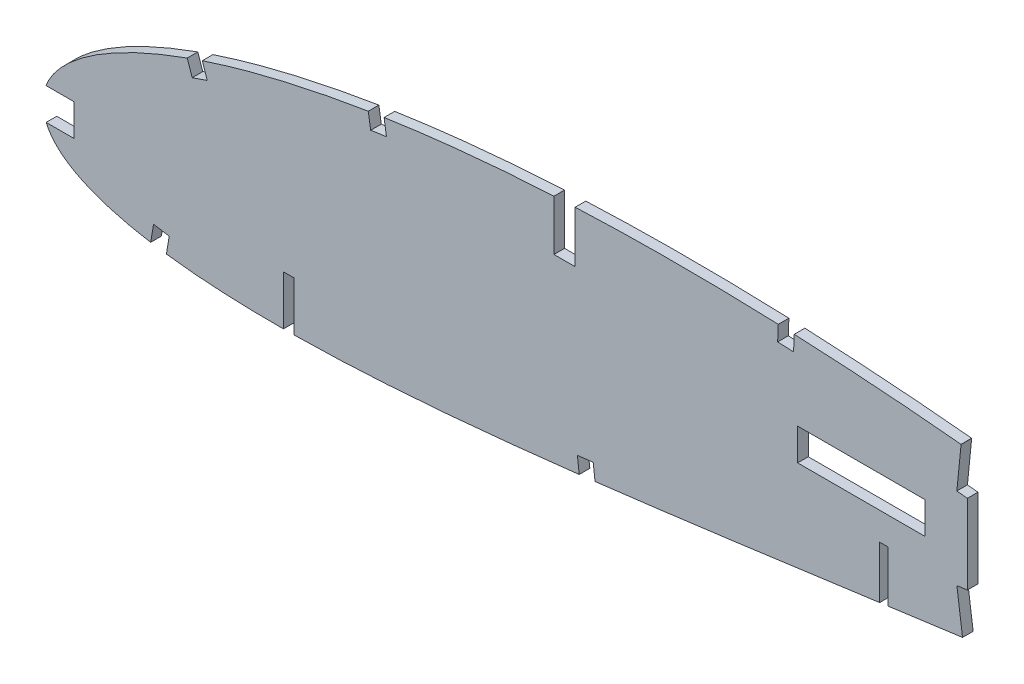
from build123d import *

# Parameters (mm, degrees)
BOSS_EXTRUDE1_DEPTH = 3.175
CUT_EXTRUDE1_DEPTH  = 7.62
SKETCH3_R           = 6.35
CUT_EXTRUDE2_DEPTH  = 7.62
SKETCH4_R           = 6.35
SKETCH4_W           = 9.525
SKETCH4_H           = 9.525
SKETCH4_W_2         = 38.1
CUT_EXTRUDE3_DEPTH  = 443.627115857


with BuildPart() as part:
    # Sketch1 → Boss-Extrude1 (new body)
    with BuildSketch(Plane.XY):
        with BuildLine():
            Line((435.33010469, 0.678691456), (439.172882547, -1.614212492))
            Line((439.172882547, -1.614212492), (434.787151486, -0.678691456))
            add(Edge.make_bspline(
                [(0, 0), (0.11179123, -0.527729161), (0.335887463, -1.58561283), (0.94472768, -3.108527015), (1.749889805, -4.572488672), (2.768272335, -5.973609192), (3.993104005, -7.311505618), (5.421679636, -8.587569541), (7.052598221, -9.801114861), (8.883725224, -10.951589231), (10.912400596, -12.040213999), (13.136344152, -13.066312264), (15.553528081, -14.029563428), (18.161318821, -14.928679795), (20.956528242, -15.765030781), (23.936498821, -16.536578215), (27.097842034, -17.244400464), (30.437517266, -17.886690773), (33.951885298, -18.464101669), (37.637295209, -18.976309975), (41.489964184, -19.423636044), (45.506112459, -19.80514129), (49.681767661, -20.121646285), (54.012767863, -20.373360955), (58.494909036, -20.561083494), (63.123897762, -20.684100336), (67.895200479, -20.744329207), (72.804505265, -20.742674403), (77.847009648, -20.678693244), (83.018406129, -20.555920262), (88.313732191, -20.373577887), (93.728207214, -20.133872554), (99.256947275, -19.839216685), (104.89499369, -19.49060908), (110.637384794, -19.089594814), (116.479134607, -18.639389777), (122.414936441, -18.141116951), (128.439613477, -17.597680601), (134.547832047, -17.011801372), (140.734314746, -16.385333349), (146.993600903, -15.721223571), (153.320115485, -15.021624036), (159.708476563, -14.290267097), (166.152848405, -13.528475979), (172.647781594, -12.740600204), (179.187166024, -11.928145018), (185.765533466, -11.094239816), (192.376967293, -10.242811017), (199.015278084, -9.37376151), (205.674882543, -8.493282903), (212.349358377, -7.600650086), (219.032895906, -6.7004538), (225.719308248, -5.795492203), (232.402082768, -4.886043807), (239.075345122, -3.975877517), (245.732904616, -3.06749205), (252.368240069, -2.160970285), (258.975348295, -1.26081803), (265.547576185, -0.366925322), (272.078863439, 0.518895586), (278.562951189, 1.394000598), (284.993721977, 2.257285217), (291.364542133, 3.108203268), (297.66900214, 3.947074317), (303.806375969, 4.748436439), (309.760626579, 5.554962658), (315.551818652, 6.216135275), (321.27090305, 6.780469964), (326.923820465, 7.243146515), (332.503782957, 7.610821489), (338.004397185, 7.886122043), (343.419107553, 8.072891719), (348.74107448, 8.176671364), (353.963650696, 8.200094537), (359.079707468, 8.150631139), (364.082590991, 8.032268225), (368.965318868, 7.850318702), (373.721079318, 7.610921079), (378.343117125, 7.320601554), (382.824493294, 6.983642622), (387.158963185, 6.607910686), (391.339839301, 6.198906082), (395.360701925, 5.761301701), (399.215684034, 5.304267166), (402.898615263, 4.830811549), (406.403955911, 4.348715399), (409.726063296, 3.862864382), (412.859676284, 3.379461168), (415.799871302, 2.903117573), (418.541899149, 2.440155772), (421.081464376, 1.994901374), (423.414160264, 1.571702591), (425.536750687, 1.175899009), (427.445043551, 0.809456817), (429.136486586, 0.478415007), (430.607934716, 0.184234372), (431.857230885, -0.068940506), (432.88219343, -0.280110359), (433.681265576, -0.445808771), (434.252869013, -0.566300363), (434.596385478, -0.637999126), (434.749014267, -0.670556399), (434.787151486, -0.678691456)],
                knots=[0, 0, 0, 0, 0.003638255, 0.007293231, 0.011028136, 0.014901081, 0.018963272, 0.023258475, 0.027820626, 0.032679082, 0.03785316, 0.043361875, 0.049214679, 0.055422346, 0.061988786, 0.068918036, 0.076211157, 0.083868392, 0.091887411, 0.100265912, 0.108999867, 0.118084529, 0.127514843, 0.13728527, 0.147387917, 0.157816481, 0.168563473, 0.179619128, 0.190977373, 0.202626974, 0.214560478, 0.226767249, 0.239236417, 0.251959004, 0.264923894, 0.278119703, 0.291536035, 0.30516028, 0.318980685, 0.332985499, 0.34716279, 0.361498603, 0.375980747, 0.390597192, 0.405332593, 0.420174823, 0.435109533, 0.450124276, 0.465203068, 0.480333154, 0.495500583, 0.510689775, 0.525887334, 0.541078314, 0.556247233, 0.571381785, 0.58646604, 0.601484515, 0.616424329, 0.631269423, 0.646006524, 0.660620684, 0.675098187, 0.689422858, 0.703581825, 0.716907563, 0.730009274, 0.742952128, 0.755725557, 0.768319951, 0.780724337, 0.792926528, 0.804916041, 0.816679084, 0.828203525, 0.8394749, 0.850481359, 0.861207697, 0.871639326, 0.881763414, 0.891563605, 0.901027365, 0.910138977, 0.918883977, 0.927249278, 0.935221104, 0.942784739, 0.949928188, 0.956638465, 0.962904203, 0.968712288, 0.974054485, 0.978918432, 0.983297219, 0.987180246, 0.990560674, 0.993433357, 0.995790626, 0.997629588, 0.998945816, 0.999736592, 1, 1, 1, 1], degree=3))
            add(Edge.make_bspline(
                [(435.33010469, 0.678691456), (435.296755582, 0.699293055), (435.163488681, 0.781619431), (434.863214309, 0.965803828), (434.363194901, 1.272571896), (433.663211466, 1.69979322), (432.763807452, 2.246333125), (431.664530435, 2.908364558), (430.366066728, 3.683736897), (428.86873043, 4.568782589), (427.172675107, 5.559358025), (425.278546429, 6.651449737), (423.186509465, 7.838875427), (420.897374442, 9.116782681), (418.411926851, 10.4790944), (415.730636684, 11.919657082), (412.854464224, 13.43114364), (409.784513475, 15.00705265), (406.521344218, 16.638681918), (403.066494801, 18.319240705), (399.421116368, 20.040349747), (395.586453278, 21.79282696), (391.56470833, 23.569527811), (387.356993489, 25.359407096), (382.965706604, 27.15470981), (378.392717175, 28.945218407), (373.640732922, 30.722778715), (368.711587102, 32.475875028), (363.608964359, 34.196846251), (358.335340013, 35.87451254), (352.894485425, 37.499762392), (347.289561815, 39.062058655), (341.52524157, 40.553388886), (335.605180365, 41.962892679), (329.534395845, 43.28113527), (323.317713598, 44.500180123), (316.960347344, 45.607856696), (310.479914041, 46.603301327), (303.980682286, 47.431342852), (297.494822244, 48.243461645), (291.0186212, 49.006373108), (284.46326746, 49.736966294), (277.835067652, 50.431127833), (271.140596349, 51.086687253), (264.386630807, 51.700815013), (257.580189535, 52.27171033), (250.727858804, 52.796138155), (243.836864005, 53.273290553), (236.914017847, 53.698972807), (229.966694004, 54.072865307), (223.001944897, 54.392360355), (216.027018499, 54.655256617), (209.049321182, 54.859966995), (202.076096041, 55.004530305), (195.114893299, 55.088037667), (188.172953688, 55.108207309), (181.257823923, 55.064678381), (174.376745271, 54.95595632), (167.537272154, 54.780552763), (160.7466557, 54.538140281), (154.012238926, 54.228824112), (147.341395315, 53.850013849), (140.741361553, 53.404123644), (134.219487317, 52.889280335), (127.782938298, 52.305347044), (121.438460058, 51.65475786), (115.193116172, 50.935743156), (109.053599754, 50.150348891), (103.026626206, 49.300114834), (97.118957953, 48.384577869), (91.33692342, 47.406382542), (85.686763085, 46.366529581), (80.174454785, 45.268067638), (74.805999973, 44.111283189), (69.587081438, 42.899646299), (64.52312301, 41.635267927), (59.619568317, 40.320462769), (54.881388132, 38.958385816), (50.313373811, 37.552127128), (45.920850559, 36.103231966), (41.707138151, 34.617193881), (37.677412709, 33.095067788), (33.834761135, 31.541542875), (30.183686712, 29.958740393), (26.726916941, 28.351485511), (23.468364091, 26.721608068), (20.41035055, 25.073674406), (17.555946308, 23.410211446), (14.907899047, 21.73430892), (12.467321746, 20.050217809), (10.237579271, 18.35899521), (8.219437586, 16.664914738), (6.414173801, 14.97055608), (4.824368385, 13.277086383), (3.449964137, 11.587487839), (2.292762263, 9.903098559), (1.352963468, 8.225512409), (0.632693499, 6.555947979), (0.13123808, 4.895344207), (-0.143255259, 3.246152095), (-0.211578297, 1.607049514), (-0.07042072, 0.534882766), (0, 0)],
                knots=[0, 0, 0, 0, 0.00025409, 0.001015373, 0.002283359, 0.004056577, 0.006330982, 0.009105274, 0.012374489, 0.016134023, 0.02037966, 0.025105976, 0.030306237, 0.035972206, 0.042099522, 0.048678064, 0.055701664, 0.063160184, 0.071045824, 0.079349826, 0.08806291, 0.097175756, 0.106678112, 0.116561573, 0.126814275, 0.137428301, 0.148393618, 0.15969976, 0.171338126, 0.183297699, 0.195569604, 0.208143556, 0.221011593, 0.234161831, 0.24758745, 0.261276822, 0.27522271, 0.289414144, 0.303771199, 0.317689227, 0.331784111, 0.346039677, 0.36044387, 0.37498272, 0.389640454, 0.404403316, 0.419256601, 0.434186749, 0.449177265, 0.464214782, 0.479284009, 0.49436974, 0.509457833, 0.524532346, 0.53957932, 0.554582984, 0.569529546, 0.584403417, 0.599190992, 0.613876838, 0.628447475, 0.642888675, 0.657186054, 0.671325546, 0.685294014, 0.699078147, 0.712665095, 0.726042645, 0.739197713, 0.752117586, 0.764792042, 0.777208152, 0.789355685, 0.80122396, 0.812803686, 0.824082909, 0.835054602, 0.845709571, 0.856037853, 0.866033834, 0.875688843, 0.884997719, 0.893953426, 0.902552897, 0.910789386, 0.918660734, 0.926166253, 0.933302626, 0.94007122, 0.94647478, 0.952517526, 0.958204819, 0.963546652, 0.9685566, 0.973249913, 0.977651041, 0.981787043, 0.985694226, 0.989415109, 0.993001157, 0.996508416, 1, 1, 1, 1], degree=3))
        make_face()
    extrude(amount=BOSS_EXTRUDE1_DEPTH)

    # Sketch2 → Cut-Extrude1 (cut)
    with BuildSketch(Plane(origin=(0, 0, 0), x_dir=(-1, 0, 0), z_dir=(0, 0, -1))):
        Polygon((-252.794440989, 13.221493744), (-250.254440989, 13.221493744), (-250.254440989, -2.115243028), (-250.254440989, -3.986349358), (-252.794440989, -3.050796193), (-252.794440989, -2.115243028), align=None)
        Polygon((-159.131940989, 54.422217902), (-159.131940989, 39.039100326), (-152.781940989, 39.039100326), (-152.781940989, 54.422217902), (-152.781940989, 57.645440557), (-159.131940989, 55.540936844), align=None)
        Polygon((-74.994440989, -5.928775484), (-74.994440989, -20.141805429), (-74.994440989, -20.97642061), (-71.819440989, -22.145862066), (-71.819440989, -20.141805429), (-71.819440989, -5.928775484), align=None)
    extrude(amount=-CUT_EXTRUDE1_DEPTH, mode=Mode.SUBTRACT)

    # Sketch3 → Cut-Extrude2 (cut)
    with BuildSketch(Plane(origin=(0, 0, 0), x_dir=(-1, 0, 0), z_dir=(0, 0, -1))):
        with Locations((-292.383806588, 26.255421435)):
            Circle(SKETCH3_R)
    extrude(amount=-CUT_EXTRUDE2_DEPTH, mode=Mode.SUBTRACT)

    # Sketch4 → Cut-Extrude3 (cut, through all)
    # profile 1 of 8: a face of its own
    with BuildSketch(Plane.XY.offset(3.175)):
        Polygon((273.349658498, 38.028091323), (276.508806588, 37.713859181), (276.508806588, 13.934637567), (273.362227422, 13.510785566), (275.057635426, 0.924468904), (275.057635426, -18.833084933), (446.086196565, -18.833084933), (446.086196565, 59.944128913), (274.606587067, 59.944128913), (274.606587067, 50.664683683), align=None)
        with Locations((292.383806588, 26.255421435)):
            Circle(SKETCH4_R, mode=Mode.SUBTRACT)
    # profile 2 of 8: a face of its own
    with BuildSketch(Plane.XY.offset(3.175)):
        Polygon((219.725798523, 49.849814949), (224.483551568, 49.643099482), (224.699134715, 54.39602519), (219.913383026, 54.599169296), align=None)
    # profile 3 of 8: a face of its own
    with BuildSketch(Plane.XY.offset(3.175)):
        Polygon((160.344166624, -14.245519658), (165.08273478, -13.687201683), (164.522590598, -8.953423812), (159.793087001, -9.513059826), align=None)
    # profile 4 of 8: a face of its own
    with BuildSketch(Plane.XY.offset(3.175)):
        Polygon((97.936400792, 43.798607145), (102.645386654, 44.510393866), (101.932356003, 49.227816219), (97.189663066, 48.482556517), align=None)
    # profile 5 of 8: a face of its own
    with BuildSketch(Plane.XY.offset(3.175)):
        Polygon((32.952371753, -13.02357497), (31.569110721, -21.303459904), (36.2027681, -22.077571832), (36.838817299, -18.581245887), (37.641753761, -13.808241987), align=None)
    # profile 6 of 8: a face of its own
    with BuildSketch(Plane.XY.offset(3.175)):
        Polygon((44.512019179, 30.71972624), (49.020517996, 32.253888691), (47.492010314, 36.746220213), (42.989627567, 35.192918258), align=None)
    # profile 7 of 8: a face of its own
    with BuildSketch(Plane.XY.offset(3.175)):
        with Locations((4.32104865, 2.047838827)):
            Rectangle(SKETCH4_W, SKETCH4_H)
    # profile 8 of 8: a face of its own
    with BuildSketch(Plane.XY.offset(3.175)):
        with Locations((244.758806588, 26.255421435)):
            Rectangle(SKETCH4_W_2, SKETCH4_H)
    extrude(amount=-CUT_EXTRUDE3_DEPTH, mode=Mode.SUBTRACT)


solid = part.part
